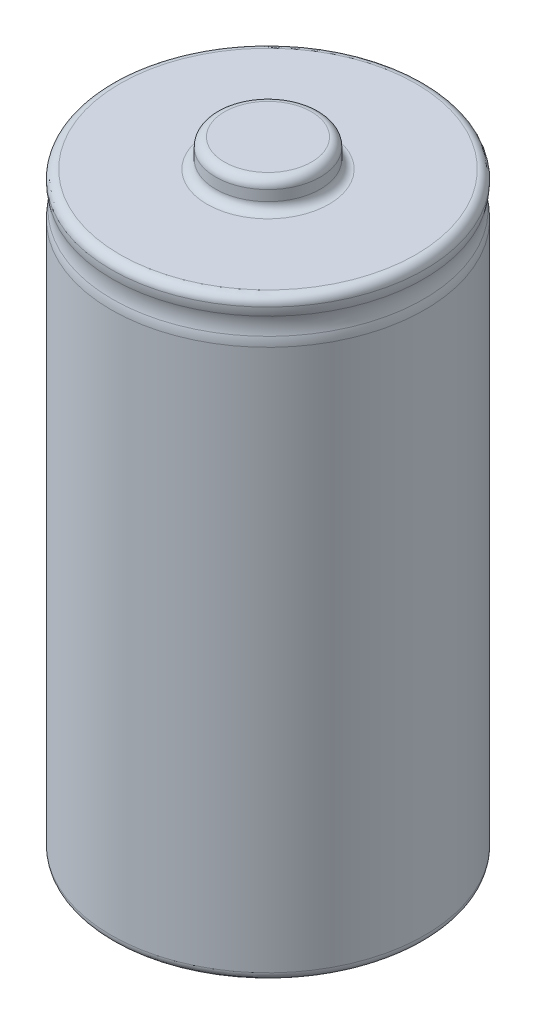
from build123d import *

# Parameters (mm, degrees)
FILLET1_R = 0.5


with BuildPart() as part:
    # Sketch1 → Revolve1 (revolve)
    with BuildSketch(Plane.XY):
        Polygon((0, -17.85), (0, 17.85), (3, 17.85), (3, 16.25), (9, 16.25), (9, -17.85), align=None)
    revolve(axis=Axis((0, -17.85, 0), (0, 1, 0)))

    # Fillet1
    fillet1_edges = [part.edges().sort_by_distance(p)[0] for p in [
        (-3, 17.85, 0),
        (-9, 16.25, 0),
        (-3, 16.25, 0),
        (-9, -17.85, 0),
    ]]
    fillet(fillet1_edges, radius=FILLET1_R)

    # Sketch2 → Cut-Revolve1 (revolve, cut)
    with BuildSketch(Plane.XY):
        with BuildLine():
            ThreePointArc((8.936491673, 14.25), (8.984059393, 14.002008585), (9, 13.75))
            Line((9, 13.75), (9, 15.75))
            ThreePointArc((9, 15.75), (8.984059393, 15.497991415), (8.936491673, 15.25))
            ThreePointArc((8.936491673, 15.25), (8.872983346, 14.75), (8.936491673, 14.25))
        make_face()
    revolve(axis=Axis((0, 17.85, 0), (0, -1, 0)), mode=Mode.SUBTRACT)


solid = part.part
